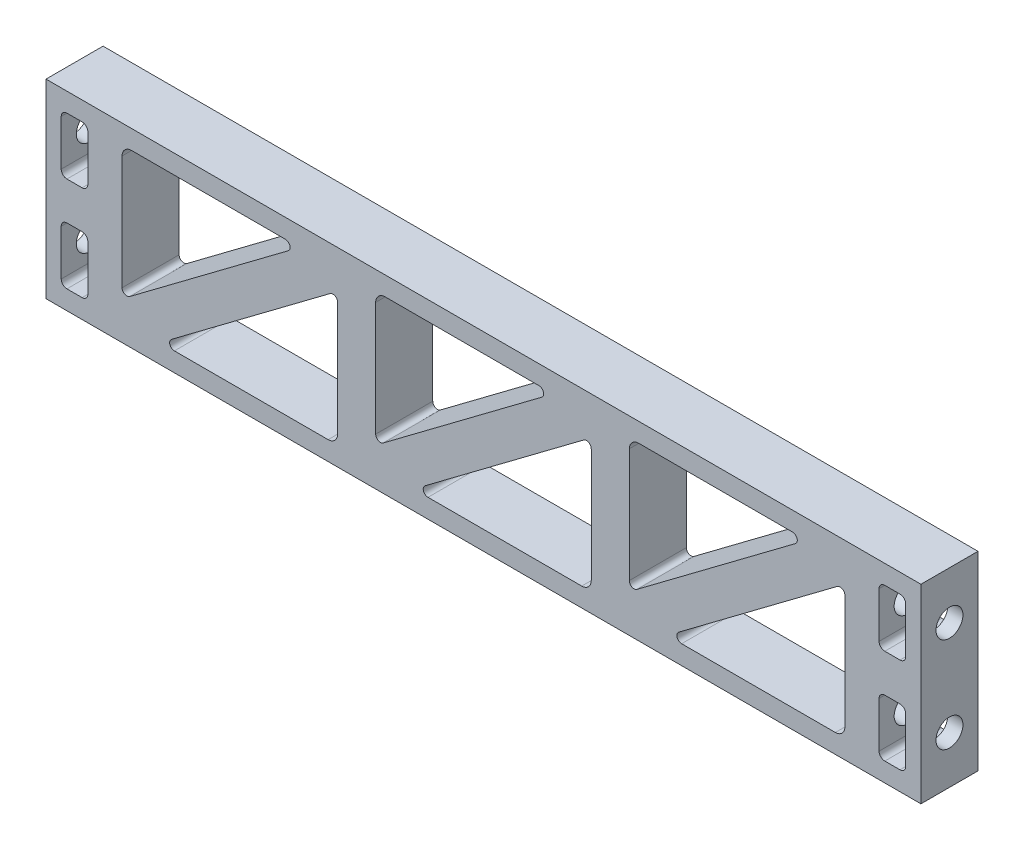
from build123d import *

# Parameters (mm, degrees)
BOSS_EXTRUDE2_DEPTH                        = 9.525
SKETCH3_R                                  = 2.2479
CUT_EXTRUDE1_DEPTH                         = 11.1125
MIRROR1_AT_THE_SECOND_PLANE_COPY_1_SKETC_R = 2.2479
MIRROR1_AT_THE_SECOND_PLANE_COPY_1_DEPTH   = 11.1125


with BuildPart() as part:
    # Sketch2 → Boss-Extrude2 (new body)
    with BuildSketch(Plane.XY):
        Polygon((-63.5, 15.875), (-73.025, 15.875), (-73.025, -15.875), (-63.5, -15.875), (-21.166666667, -15.875), (73.025, -15.875), (73.025, 15.875), (-21.166666667, 15.875), align=None)
        with BuildLine():
            Line((-66.04, -4.1275), (-66.04, -11.7475))
            ThreePointArc((-66.04, -11.7475), (-66.318980791, -12.421019209), (-66.9925, -12.7))
            Line((-66.9925, -12.7), (-69.5325, -12.7))
            ThreePointArc((-69.5325, -12.7), (-70.206019209, -12.421019209), (-70.485, -11.7475))
            Line((-70.485, -11.7475), (-70.485, -4.1275))
            ThreePointArc((-70.485, -4.1275), (-70.206019209, -3.453980791), (-69.5325, -3.175))
            Line((-69.5325, -3.175), (-66.9925, -3.175))
            ThreePointArc((-66.9925, -3.175), (-66.318980791, -3.453980791), (-66.04, -4.1275))
        make_face(mode=Mode.SUBTRACT)
        with BuildLine():
            Line((-25.929166667, -12.7), (-51.59375, -12.7))
            ThreePointArc((-51.59375, -12.7), (-52.346767368, -12.157255789), (-52.07, -11.27125))
            Line((-52.07, -11.27125), (-25.611666667, 8.5725))
            ThreePointArc((-25.611666667, 8.5725), (-24.780440875, 8.647451583), (-24.341666667, 7.9375))
            Line((-24.341666667, 7.9375), (-24.341666667, -11.1125))
            ThreePointArc((-24.341666667, -11.1125), (-24.806634652, -12.235032015), (-25.929166667, -12.7))
        make_face(mode=Mode.SUBTRACT)
        with BuildLine():
            ThreePointArc((70.485, -11.7475), (70.206019209, -12.421019209), (69.5325, -12.7))
            Line((69.5325, -12.7), (66.9925, -12.7))
            ThreePointArc((66.9925, -12.7), (66.318980791, -12.421019209), (66.04, -11.7475))
            Line((66.04, -11.7475), (66.04, -4.1275))
            ThreePointArc((66.04, -4.1275), (66.318980791, -3.453980791), (66.9925, -3.175))
            Line((66.9925, -3.175), (69.5325, -3.175))
            ThreePointArc((69.5325, -3.175), (70.206019209, -3.453980791), (70.485, -4.1275))
            Line((70.485, -4.1275), (70.485, -11.7475))
        make_face(mode=Mode.SUBTRACT)
        with BuildLine():
            Line((17.991666667, 7.9375), (17.991666667, -11.1125))
            ThreePointArc((17.991666667, -11.1125), (17.526698682, -12.235032015), (16.404166667, -12.7))
            Line((16.404166667, -12.7), (-9.260416667, -12.7))
            ThreePointArc((-9.260416667, -12.7), (-10.013434034, -12.157255789), (-9.736666667, -11.27125))
            Line((-9.736666667, -11.27125), (16.721666667, 8.5725))
            ThreePointArc((16.721666667, 8.5725), (17.552892458, 8.647451583), (17.991666667, 7.9375))
        make_face(mode=Mode.SUBTRACT)
        with BuildLine():
            Line((60.325, 7.9375), (60.325, -11.1125))
            ThreePointArc((60.325, -11.1125), (59.860032015, -12.235032015), (58.7375, -12.7))
            Line((58.7375, -12.7), (33.072916667, -12.7))
            ThreePointArc((33.072916667, -12.7), (32.319899299, -12.157255789), (32.596666667, -11.27125))
            Line((32.596666667, -11.27125), (59.055, 8.5725))
            ThreePointArc((59.055, 8.5725), (59.886225791, 8.647451583), (60.325, 7.9375))
        make_face(mode=Mode.SUBTRACT)
        with BuildLine():
            ThreePointArc((-60.325, 11.1125), (-59.860032015, 12.235032015), (-58.7375, 12.7))
            Line((-58.7375, 12.7), (-33.072916667, 12.7))
            ThreePointArc((-33.072916667, 12.7), (-32.319899299, 12.157255789), (-32.596666667, 11.27125))
            Line((-32.596666667, 11.27125), (-59.055, -8.5725))
            ThreePointArc((-59.055, -8.5725), (-59.886225791, -8.647451583), (-60.325, -7.9375))
            Line((-60.325, -7.9375), (-60.325, 11.1125))
        make_face(mode=Mode.SUBTRACT)
        with BuildLine():
            Line((9.736666667, 11.27125), (-16.721666667, -8.5725))
            ThreePointArc((-16.721666667, -8.5725), (-17.552892458, -8.647451583), (-17.991666667, -7.9375))
            Line((-17.991666667, -7.9375), (-17.991666667, 11.1125))
            ThreePointArc((-17.991666667, 11.1125), (-17.526698682, 12.235032015), (-16.404166667, 12.7))
            Line((-16.404166667, 12.7), (9.260416667, 12.7))
            ThreePointArc((9.260416667, 12.7), (10.013434034, 12.157255789), (9.736666667, 11.27125))
        make_face(mode=Mode.SUBTRACT)
        with BuildLine():
            ThreePointArc((-70.485, 11.7475), (-70.206019209, 12.421019209), (-69.5325, 12.7))
            Line((-69.5325, 12.7), (-66.9925, 12.7))
            ThreePointArc((-66.9925, 12.7), (-66.318980791, 12.421019209), (-66.04, 11.7475))
            Line((-66.04, 11.7475), (-66.04, 4.1275))
            ThreePointArc((-66.04, 4.1275), (-66.318980791, 3.453980791), (-66.9925, 3.175))
            Line((-66.9925, 3.175), (-69.5325, 3.175))
            ThreePointArc((-69.5325, 3.175), (-70.206019209, 3.453980791), (-70.485, 4.1275))
            Line((-70.485, 4.1275), (-70.485, 11.7475))
        make_face(mode=Mode.SUBTRACT)
        with BuildLine():
            Line((52.07, 11.27125), (25.611666667, -8.5725))
            ThreePointArc((25.611666667, -8.5725), (24.780440875, -8.647451583), (24.341666667, -7.9375))
            Line((24.341666667, -7.9375), (24.341666667, 11.1125))
            ThreePointArc((24.341666667, 11.1125), (24.806634652, 12.235032015), (25.929166667, 12.7))
            Line((25.929166667, 12.7), (51.59375, 12.7))
            ThreePointArc((51.59375, 12.7), (52.346767368, 12.157255789), (52.07, 11.27125))
        make_face(mode=Mode.SUBTRACT)
        with BuildLine():
            Line((66.04, 4.1275), (66.04, 11.7475))
            ThreePointArc((66.04, 11.7475), (66.318980791, 12.421019209), (66.9925, 12.7))
            Line((66.9925, 12.7), (69.5325, 12.7))
            ThreePointArc((69.5325, 12.7), (70.206019209, 12.421019209), (70.485, 11.7475))
            Line((70.485, 11.7475), (70.485, 4.1275))
            ThreePointArc((70.485, 4.1275), (70.206019209, 3.453980791), (69.5325, 3.175))
            Line((69.5325, 3.175), (66.9925, 3.175))
            ThreePointArc((66.9925, 3.175), (66.318980791, 3.453980791), (66.04, 4.1275))
        make_face(mode=Mode.SUBTRACT)
    extrude(amount=BOSS_EXTRUDE2_DEPTH)

    # Sketch3 → Cut-Extrude1 (cut)
    with BuildSketch(Plane.ZY.offset(73.025)):
        with Locations((4.7625, 7.9375)):
            Circle(SKETCH3_R)
    cut_extrude1 = extrude(amount=-CUT_EXTRUDE1_DEPTH, mode=Mode.SUBTRACT)

    # Mirror1: Cut-Extrude1 across plane
    add(cut_extrude1.mirror(Plane(origin=(0, 0, 0), x_dir=(0, 0, 1), z_dir=(1, 0, 0))), mode=Mode.SUBTRACT)

    # Mirror1 at the second plane: Cut-Extrude1 across plane
    add(cut_extrude1.mirror(Plane.ZX), mode=Mode.SUBTRACT)

    # Mirror1 at the second plane copy 1 sketc → Mirror1 at the second plane copy 1 (cut)
    with BuildSketch(Plane(origin=(73.025, 0, 0), x_dir=(0, 0, 1), z_dir=(1, 0, 0))):
        with Locations((4.7625, 7.9375)):
            Circle(MIRROR1_AT_THE_SECOND_PLANE_COPY_1_SKETC_R)
    extrude(amount=-MIRROR1_AT_THE_SECOND_PLANE_COPY_1_DEPTH, mode=Mode.SUBTRACT)


solid = part.part
